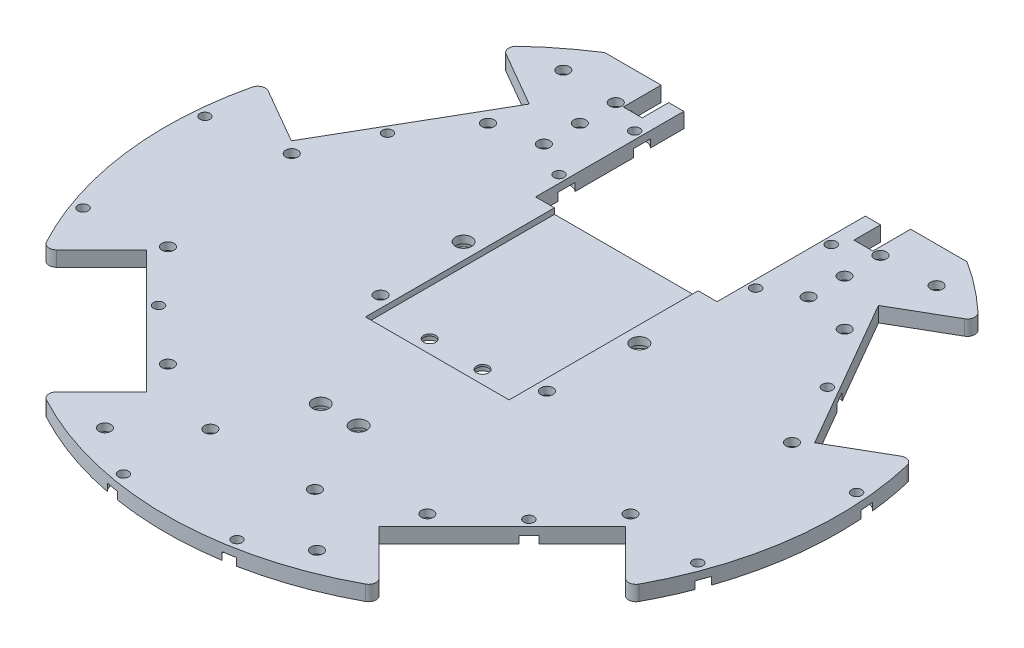
from build123d import *

# Parameters (mm, degrees)
BOSS_EXTRUDE1_DEPTH                                = 4
CUT_EXTRUDE1_DEPTH                                 = 4
SKETCH3_W                                          = 38
SKETCH3_H                                          = 50
CUT_EXTRUDE2_DEPTH                                 = 1.5
CHAMFER1_SIZE                                      = 4
CBORE_FOR_M2_5_PAN_HEAD_MACHINE_SCREW1_D           = 2.7
CBORE_FOR_M2_5_PAN_HEAD_MACHINE_SCREW1_CBORE_D     = 6
CBORE_FOR_M2_5_PAN_HEAD_MACHINE_SCREW1_CBORE_DEPTH = 2.1
CBORE_FOR_M3_PAN_HEAD_MACHINE_SCREW5_D             = 3.2
CBORE_FOR_M3_PAN_HEAD_MACHINE_SCREW5_CBORE_D       = 6
CBORE_FOR_M3_PAN_HEAD_MACHINE_SCREW5_CBORE_DEPTH   = 2
CBORE_FOR_M3_PAN_HEAD_MACHINE_SCREW1_D             = 3.2
CBORE_FOR_M3_PAN_HEAD_MACHINE_SCREW1_CBORE_D       = 6
CBORE_FOR_M3_PAN_HEAD_MACHINE_SCREW1_CBORE_DEPTH   = 2
CBORE_FOR_M3_PAN_HEAD_MACHINE_SCREW2_D             = 3.2
CBORE_FOR_M3_PAN_HEAD_MACHINE_SCREW2_CBORE_D       = 6
CBORE_FOR_M3_PAN_HEAD_MACHINE_SCREW2_CBORE_DEPTH   = 2
CBORE_FOR_M2_5_PAN_HEAD_MACHINE_SCREW3_D           = 2.7
CBORE_FOR_M2_5_PAN_HEAD_MACHINE_SCREW3_CBORE_D     = 6
CBORE_FOR_M2_5_PAN_HEAD_MACHINE_SCREW3_CBORE_DEPTH = 2
CBORE_FOR_M4_PAN_HEAD_MACHINE_SCREW1_D             = 4.3
CBORE_FOR_M4_PAN_HEAD_MACHINE_SCREW1_CBORE_D       = 8
CBORE_FOR_M4_PAN_HEAD_MACHINE_SCREW1_CBORE_DEPTH   = 2
CBORE_FOR_M2_5_PAN_HEAD_MACHINE_SCREW4_D           = 2.7
CBORE_FOR_M2_5_PAN_HEAD_MACHINE_SCREW4_CBORE_D     = 6
CBORE_FOR_M2_5_PAN_HEAD_MACHINE_SCREW4_CBORE_DEPTH = 2
CBORE_FOR_M3_PAN_HEAD_MACHINE_SCREW3_D             = 3.2
CBORE_FOR_M3_PAN_HEAD_MACHINE_SCREW3_CBORE_D       = 6
CBORE_FOR_M3_PAN_HEAD_MACHINE_SCREW3_CBORE_DEPTH   = 2
CBORE_FOR_M3_PAN_HEAD_MACHINE_SCREW4_D             = 3.2
CBORE_FOR_M3_PAN_HEAD_MACHINE_SCREW4_CBORE_D       = 6
CBORE_FOR_M3_PAN_HEAD_MACHINE_SCREW4_CBORE_DEPTH   = 2


with BuildPart() as part:
    # Sketch1 → Boss-Extrude1 (new body)
    with BuildSketch(Plane(origin=(0, 0, 0), x_dir=(1, 0, 0), z_dir=(0, 1, 0))):
        with BuildLine():
            Line((0, 75), (47.916594203, 75))
            ThreePointArc((47.916594203, 75), (54.699888264, 70.206283365), (61.006740169, 64.801062136))
            ThreePointArc((61.006740169, 64.801062136), (61.62240188, 63.113727229), (60.635802188, 61.612807685))
            Line((60.635802188, 61.612807685), (46.20090966, 53.278818598))
            Line((46.20090966, 53.278818598), (57.72108744, 33.325285371))
            Line((57.72108744, 33.325285371), (69.228961563, 13.393062702))
            Line((69.228961563, 13.393062702), (83.670255284, 21.73074752))
            ThreePointArc((83.670255284, 21.73074752), (85.463118464, 21.834825242), (86.616697934, 20.458436866))
            ThreePointArc((86.616697934, 20.458436866), (88.239013021, -11.613637717), (78.373325194, -42.173710982))
            ThreePointArc((78.373325194, -42.173710982), (76.902820477, -43.204748679), (75.197913313, -42.640200702))
            Line((75.197913313, -42.640200702), (63.384677446, -30.826964836))
            Line((63.384677446, -30.826964836), (47.105821141, -47.105821141))
            Line((47.105821141, -47.105821141), (30.820069881, -63.3915724))
            Line((30.820069881, -63.3915724), (42.631234791, -75.20273731))
            ThreePointArc((42.631234791, -75.20273731), (43.195765755, -76.907760257), (42.164538958, -78.378260088))
            ThreePointArc((42.164538958, -78.378260088), (-0.020248235, -88.999997697), (-42.200197995, -78.359066413))
            ThreePointArc((-42.200197995, -78.359066413), (-43.230689576, -76.888547713), (-42.666092501, -75.183974954))
            Line((-42.666092501, -75.183974954), (-30.783470347, -63.3013528))
            Line((-30.783470347, -63.3013528), (-47.042411574, -47.042411574))
            Line((-47.042411574, -47.042411574), (-63.311169016, -30.773654131))
            Line((-63.311169016, -30.773654131), (-75.190846139, -42.653331255))
            ThreePointArc((-75.190846139, -42.653331255), (-76.895583725, -43.217904137), (-78.366095557, -42.187143387))
            ThreePointArc((-78.366095557, -42.187143387), (-88.238376878, -11.618470038), (-86.615432014, 20.463795761))
            ThreePointArc((-86.615432014, 20.463795761), (-85.461824191, 21.840088238), (-83.669017812, 21.73598599))
            Line((-83.669017812, 21.73598599), (-69.130261206, 13.342030949))
            Line((-69.130261206, 13.342030949), (-57.624964774, 33.269788925))
            Line((-57.624964774, 33.269788925), (-46.103964049, 53.224747534))
            Line((-46.103964049, 53.224747534), (-60.634550846, 61.613985733))
            ThreePointArc((-60.634550846, 61.613985733), (-61.621152822, 63.114924899), (-61.005460061, 64.802267265))
            ThreePointArc((-61.005460061, 64.802267265), (-54.699194825, 70.206823639), (-47.916594203, 75))
            Line((-47.916594203, 75), (0, 75))
        make_face()
    extrude(amount=BOSS_EXTRUDE1_DEPTH)

    # Sketch2 → Cut-Extrude1 (cut)
    with BuildSketch(Plane(origin=(0, 4, 0), x_dir=(1, 0, 0), z_dir=(0, 1, 0))):
        Polygon((33, 75), (-33, 75), (-33, 69), (-28, 69), (-28, 72), (-24, 72), (-24, 32.8), (24, 32.8), (24, 72), (28, 72), (28, 69), (33, 69), align=None)
    extrude(amount=-CUT_EXTRUDE1_DEPTH, mode=Mode.SUBTRACT)

    # Sketch3 → Cut-Extrude2 (cut)
    with BuildSketch(Plane(origin=(0, 4, 0), x_dir=(1, 0, 0), z_dir=(0, 1, 0))):
        with Locations((0, 7.8)):
            Rectangle(SKETCH3_W, SKETCH3_H)
    extrude(amount=-CUT_EXTRUDE2_DEPTH, mode=Mode.SUBTRACT)

    # Chamfer1
    chamfer1_edges = [part.edges().sort_by_distance(p)[0] for p in [
        (30.5, 4, -69),
        (-30.5, 4, -69),
    ]]
    chamfer(chamfer1_edges, length=CHAMFER1_SIZE - 0.0001)  # a hair under: the kernel refuses the full size

    # CBORE for M2.5 Pan Head Machine Screw1 (through all)
    with Locations(Plane(origin=(26, 0, -61), x_dir=(0, 0, -1), z_dir=(0, -1, 0))):
        with Locations((0, 0), (-20, 0), (0, -52), (-20, -52)):
            CounterBoreHole(CBORE_FOR_M2_5_PAN_HEAD_MACHINE_SCREW1_D / 2, CBORE_FOR_M2_5_PAN_HEAD_MACHINE_SCREW1_CBORE_D / 2, CBORE_FOR_M2_5_PAN_HEAD_MACHINE_SCREW1_CBORE_DEPTH)

    # CBORE for M3 Pan Head Machine Screw5 (through all)
    with Locations(Plane(origin=(49.348831898, 0, -65.488111824), x_dir=(0, 0, -1), z_dir=(0, -1, 0))):
        with Locations((0, 0), (0, -98.697663796), (-142.542906728, -77.394483651), (-142.542906728, -21.303180145)):
            CounterBoreHole(CBORE_FOR_M3_PAN_HEAD_MACHINE_SCREW5_D / 2, CBORE_FOR_M3_PAN_HEAD_MACHINE_SCREW5_CBORE_D / 2, CBORE_FOR_M3_PAN_HEAD_MACHINE_SCREW5_CBORE_DEPTH)

    # CBORE for M3 Pan Head Machine Screw1 (through all)
    with Locations(Plane(origin=(35, 0, -65), x_dir=(0, 0, -1), z_dir=(0, -1, 0))):
        with Locations((0, 0), (-9.5, 0), (-19, 0), (0, -70), (-9.5, -70), (-19, -70)):
            CounterBoreHole(CBORE_FOR_M3_PAN_HEAD_MACHINE_SCREW1_D / 2, CBORE_FOR_M3_PAN_HEAD_MACHINE_SCREW1_CBORE_D / 2, CBORE_FOR_M3_PAN_HEAD_MACHINE_SCREW1_CBORE_DEPTH)

    # CBORE for M3 Pan Head Machine Screw2 (through all)
    with Locations(Plane(origin=(47.16967631, 0, -43.369288343), x_dir=(0, 0, -1), z_dir=(0, -1, 0))):
        with Locations((0, 0), (-32.915280708, 18.989057267), (-70.627749855, 14.000207306), (-97.488872208, -12.87878274), (-97.477466254, -81.489467297), (-70.607408569, -108.359524982), (-32.893282797, -113.3358359), (0.015682546, -94.3358359)):
            CounterBoreHole(CBORE_FOR_M3_PAN_HEAD_MACHINE_SCREW2_D / 2, CBORE_FOR_M3_PAN_HEAD_MACHINE_SCREW2_CBORE_D / 2, CBORE_FOR_M3_PAN_HEAD_MACHINE_SCREW2_CBORE_DEPTH)

    # CBORE for M2.5 Pan Head Machine Screw3 (through all)
    with Locations(Plane(origin=(58.180040239, 0, -27.786144047), x_dir=(0, 0, -1), z_dir=(0, -1, 0))):
        with Locations((0, 0), (0.019344171, -116.361744286), (-69.696729982, -107.172296936), (-69.713014961, -9.212626274)):
            CounterBoreHole(CBORE_FOR_M2_5_PAN_HEAD_MACHINE_SCREW3_D / 2, CBORE_FOR_M2_5_PAN_HEAD_MACHINE_SCREW3_CBORE_D / 2, CBORE_FOR_M2_5_PAN_HEAD_MACHINE_SCREW3_CBORE_DEPTH)

    # CBORE for M4 Pan Head Machine Screw1 (through all)
    with Locations(Plane(origin=(23.246707451, 0, -12.992269763), x_dir=(0, 0, -1), z_dir=(0, -1, 0))):
        with Locations((0, 0), (0.007730237, -46.499999357), (-55.992269763, -28.259308639), (-55.99393218, -18.259308777)):
            CounterBoreHole(CBORE_FOR_M4_PAN_HEAD_MACHINE_SCREW1_D / 2, CBORE_FOR_M4_PAN_HEAD_MACHINE_SCREW1_CBORE_D / 2, CBORE_FOR_M4_PAN_HEAD_MACHINE_SCREW1_CBORE_DEPTH)

    # CBORE for M2.5 Pan Head Machine Screw4 (through all)
    with Locations(Plane(origin=(86.170841385, 0, -7.538971748), x_dir=(0, 0, -1), z_dir=(0, -1, 0))):
        with Locations((0, 0), (-37.123714146, -4.887429687), (-92.724842384, -71.150274017), (-92.724842384, -101.191408753), (-37.123714146, -167.454253083), (0, -172.34168277)):
            CounterBoreHole(CBORE_FOR_M2_5_PAN_HEAD_MACHINE_SCREW4_D / 2, CBORE_FOR_M2_5_PAN_HEAD_MACHINE_SCREW4_CBORE_D / 2, CBORE_FOR_M2_5_PAN_HEAD_MACHINE_SCREW4_CBORE_DEPTH)

    # CBORE for M3 Pan Head Machine Screw3 (through all)
    with Locations(Plane(origin=(22, 0, 10.2), x_dir=(0, 0, -1), z_dir=(0, -1, 0))):
        with Locations((0, 0), (0, -44), (-53.1915724, -35.820069881), (-53.1915724, -8.179930119)):
            CounterBoreHole(CBORE_FOR_M3_PAN_HEAD_MACHINE_SCREW3_D / 2, CBORE_FOR_M3_PAN_HEAD_MACHINE_SCREW3_CBORE_D / 2, CBORE_FOR_M3_PAN_HEAD_MACHINE_SCREW3_CBORE_DEPTH)

    # CBORE for M3 Pan Head Machine Screw4 (through all)
    with Locations(Plane(origin=(-7, 0, 12.2), x_dir=(0, 0, -1), z_dir=(0, -1, 0))):
        with Locations((0, 0), (0, 14)):
            CounterBoreHole(CBORE_FOR_M3_PAN_HEAD_MACHINE_SCREW4_D / 2, CBORE_FOR_M3_PAN_HEAD_MACHINE_SCREW4_CBORE_D / 2, CBORE_FOR_M3_PAN_HEAD_MACHINE_SCREW4_CBORE_DEPTH)


solid = part.part
